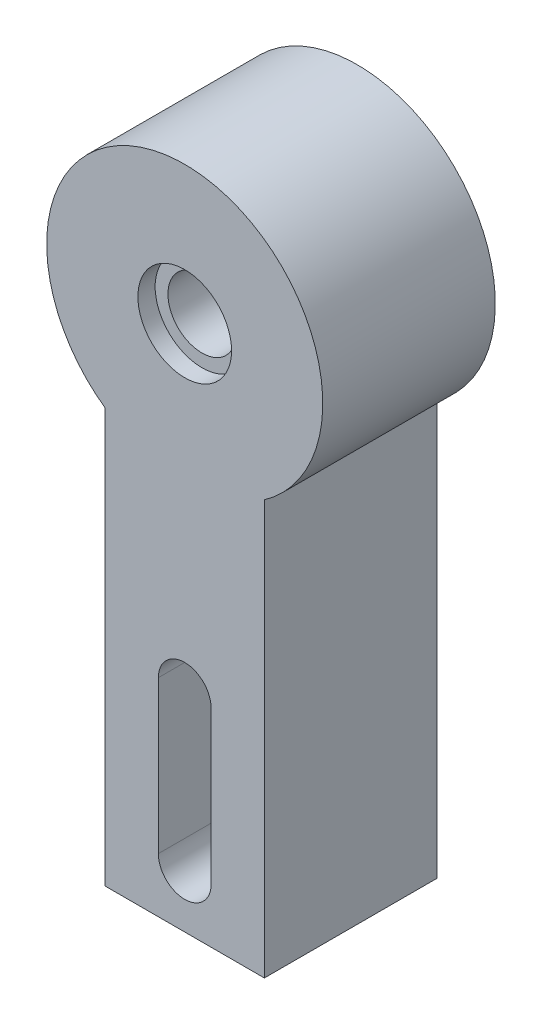
from build123d import *

# Parameters (mm, degrees)
ESTRUSIONE_ESTRUSIONE1_DEPTH = 5
TAGLIO_ESTRUSIONE1_DEPTH     = 42.761837278
SCHIZZO3_R                   = 2.715092607
TAGLIO_ESTRUSIONE2_DEPTH     = 1
SCHIZZO4_R                   = 1.973528893
TAGLIO_ESTRUSIONE3_DEPTH     = 42.533733914


with BuildPart() as part:
    # Schizzo1 → Estrusione-Estrusione1 (new, symmetric)
    with BuildSketch(Plane.XY):
        with BuildLine():
            Line((0, 0), (0, 24))
            ThreePointArc((0, 24), (4.615245069, 38.534486434), (9.230490138, 24))
            Line((9.230490138, 24), (9.230490138, 0))
            Line((9.230490138, 0), (0, 0))
        make_face()
    extrude(amount=ESTRUSIONE_ESTRUSIONE1_DEPTH, both=True)

    # Schizzo2 → Taglio-Estrusione1 (cut, through all)
    with BuildSketch(Plane.XY.offset(5)):
        with BuildLine():
            Line((6.145741, 12), (6.145741, 3.168693427))
            ThreePointArc((6.145741, 3.168693427), (4.615245069, 1.638197496), (3.084749138, 3.168693427))
            Line((3.084749138, 3.168693427), (3.084749138, 12))
            ThreePointArc((3.084749138, 12), (4.615245069, 13.530495931), (6.145741, 12))
        make_face()
    extrude(amount=-TAGLIO_ESTRUSIONE1_DEPTH, mode=Mode.SUBTRACT)

    # Schizzo3 → Taglio-Estrusione2 (cut)
    with BuildSketch(Plane.XY.offset(5)):
        with Locations((4.615245069, 30.534486434)):
            Circle(SCHIZZO3_R)
    extrude(amount=-TAGLIO_ESTRUSIONE2_DEPTH, mode=Mode.SUBTRACT)

    # Schizzo4 → Taglio-Estrusione3 (cut, through all)
    with BuildSketch(Plane.XY.offset(4)):
        with Locations((4.615245069, 30.534486434)):
            Circle(SCHIZZO4_R)
    extrude(amount=-TAGLIO_ESTRUSIONE3_DEPTH, mode=Mode.SUBTRACT)


solid = part.part
